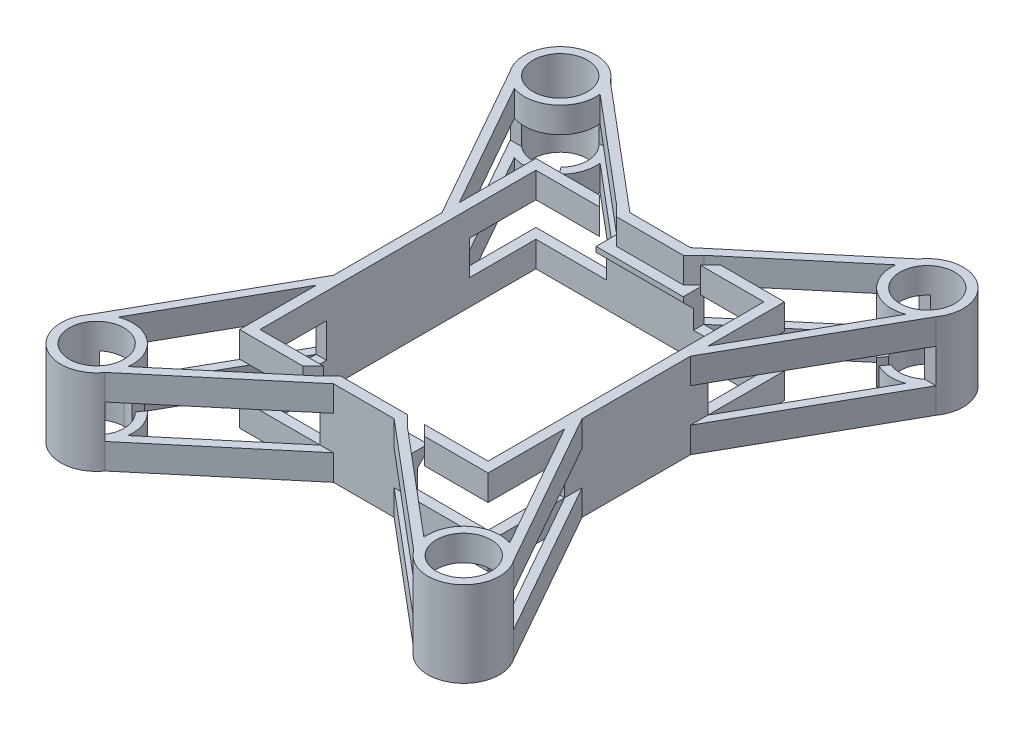
from build123d import *

# Parameters (mm, degrees)
SKETCH1_R               = 3.2
SKETCH1_W               = 26.7
SKETCH1_H               = 32.3
BOSS_EXTRUDE2_DEPTH     = 10
CUT_EXTRUDE1_DEPTH      = 68.219866013
SKETCH3_W               = 36.125771517
SKETCH3_H               = 4
CUT_EXTRUDE2_DEPTH      = 77.38869507
CUT_EXTRUDE3_REACH      = 60.207
CUT_EXTRUDE3_END_RADIUS = 3.2
SKETCH4_W               = 4.857578305
SKETCH4_H               = 4
CUT_EXTRUDE4_REACH      = 60.207
CUT_EXTRUDE4_END_RADIUS = 3.2
SKETCH5_W               = 4.857578305
SKETCH5_H               = 4
CUT_EXTRUDE5_REACH      = 60.207
CUT_EXTRUDE5_END_RADIUS = 3.2
SKETCH6_W               = 4.857578305
SKETCH6_H               = 4
CUT_EXTRUDE6_REACH      = 60.207
CUT_EXTRUDE6_END_RADIUS = 3.2
SKETCH7_W               = 4.857578305
SKETCH7_H               = 4
SKETCH8_W               = 10.205315409
SKETCH8_H               = 1.2
SKETCH8_W_2             = 1.2
SKETCH8_H_2             = 16.7681893
BOSS_EXTRUDE3_DEPTH     = 4
CUT_EXTRUDE7_DEPTH      = 52.578594453
SKETCH10_W              = 10.205315409
SKETCH10_H              = 0.6
BOSS_EXTRUDE4_DEPTH     = 1.2
CHAMFER1_SIZE           = 1.2
SKETCH12_W              = 10.205315409
SKETCH12_H              = 0.6
BOSS_EXTRUDE5_DEPTH     = 1.2
CHAMFER2_SIZE           = 1.2
CUT_EXTRUDE8_DEPTH      = 53.070638614
CUT_EXTRUDE8_DEPTH_BACK = 3


with BuildPart() as part:
    # Sketch1 → Boss-Extrude2 (new body)
    with BuildSketch(Plane(origin=(0, 0, 0), x_dir=(1, 0, 0), z_dir=(0, 1, 0))):
        with BuildLine():
            Line((-34.405486348, 30.435899661), (-24.03957695, 12.074655042))
            Line((-24.03957695, 12.074655042), (-24.03957695, -0.625344958))
            Line((-24.03957695, -0.625344958), (-34.405486348, -18.986589577))
            ThreePointArc((-34.405486348, -18.986589577), (-33.407763681, -24.841890549), (-27.552462708, -23.844167882))
            Line((-27.552462708, -23.844167882), (-13.03957695, -11.625344958))
            Line((-13.03957695, -11.625344958), (-5.93957695, -11.625344958))
            Line((-5.93957695, -11.625344958), (8.573308809, -23.844167882))
            ThreePointArc((8.573308809, -23.844167882), (14.428609781, -24.841890549), (15.426332449, -18.986589577))
            Line((15.426332449, -18.986589577), (5.06042305, -0.625344958))
            Line((5.06042305, -0.625344958), (5.06042305, 12.074655042))
            Line((5.06042305, 12.074655042), (15.426332449, 30.435899661))
            ThreePointArc((15.426332449, 30.435899661), (14.428609781, 36.291200634), (8.573308809, 35.293477966))
            Line((8.573308809, 35.293477966), (-5.93957695, 23.074655042))
            Line((-5.93957695, 23.074655042), (-13.03957695, 23.074655042))
            Line((-13.03957695, 23.074655042), (-27.552462708, 35.293477966))
            ThreePointArc((-27.552462708, 35.293477966), (-33.407763681, 36.291200634), (-34.405486348, 30.435899661))
        make_face()
        with Locations(Location((-30.978974528, 32.864688814, 0), (0, 0, 270))):
            Circle(SKETCH1_R, mode=Mode.SUBTRACT)
        with Locations(Location((11.999820629, 32.864688814, 0), (0, 0, 90))):
            Circle(SKETCH1_R, mode=Mode.SUBTRACT)
        with Locations(Location((-30.978974528, -21.415378729, 0), (0, 0, 90))):
            Circle(SKETCH1_R, mode=Mode.SUBTRACT)
        with Locations(Location((11.999820629, -21.415378729, 0), (0, 0, 270))):
            Circle(SKETCH1_R, mode=Mode.SUBTRACT)
        with BuildLine():
            Line((-24.03957695, 23.074655042), (-14.592234654, 23.074655042))
            Line((-14.592234654, 23.074655042), (-26.808244007, 33.359670553))
            ThreePointArc((-26.808244007, 33.359670553), (-28.363078678, 29.578796408), (-32.396270044, 28.911048286))
            Line((-32.396270044, 28.911048286), (-24.03957695, 14.108749692))
            Line((-24.03957695, 14.108749692), (-24.03957695, 23.074655042))
        make_face(mode=Mode.SUBTRACT)
        with Locations((-9.48957695, 5.724655042)):
            Rectangle(SKETCH1_W, SKETCH1_H, mode=Mode.SUBTRACT)
        with BuildLine():
            Line((5.06042305, 23.074655042), (5.06042305, 14.108749692))
            Line((5.06042305, 14.108749692), (13.417116145, 28.911048286))
            ThreePointArc((13.417116145, 28.911048286), (9.383924779, 29.578796408), (7.829090108, 33.359670553))
            Line((7.829090108, 33.359670553), (-4.386919245, 23.074655042))
            Line((-4.386919245, 23.074655042), (5.06042305, 23.074655042))
        make_face(mode=Mode.SUBTRACT)
        with BuildLine():
            Line((-24.03957695, -11.625344958), (-14.592234654, -11.625344958))
            Line((-14.592234654, -11.625344958), (-26.808244007, -21.910360468))
            ThreePointArc((-26.808244007, -21.910360468), (-28.363078678, -18.129486324), (-32.396270044, -17.461738202))
            Line((-32.396270044, -17.461738202), (-24.03957695, -2.659439608))
            Line((-24.03957695, -2.659439608), (-24.03957695, -11.625344958))
        make_face(mode=Mode.SUBTRACT)
        with BuildLine():
            Line((7.829090108, -21.910360468), (-4.386919245, -11.625344958))
            Line((-4.386919245, -11.625344958), (5.06042305, -11.625344958))
            Line((5.06042305, -11.625344958), (5.06042305, -2.659439608))
            Line((5.06042305, -2.659439608), (13.417116145, -17.461738202))
            ThreePointArc((13.417116145, -17.461738202), (9.383924779, -18.129486324), (7.829090108, -21.910360468))
        make_face(mode=Mode.SUBTRACT)
    extrude(amount=BOSS_EXTRUDE2_DEPTH)

    # Sketch2 → Cut-Extrude1 (cut, through all)
    with BuildSketch(Plane(origin=(20, 0, 0), x_dir=(0, 0, -1), z_dir=(1, 0, 0))):
        Polygon((-18.986589577, 5), (-18.986589577, 7), (-0.625344958, 7), (-0.625344958, 5), (-0.625344958, 3), (-18.986589577, 3), align=None)
        Polygon((30.435899661, 7), (12.074655042, 7), (12.074655042, 5), (12.074655042, 3), (30.435899661, 3), (30.435899661, 5), align=None)
    extrude(amount=-CUT_EXTRUDE1_DEPTH, mode=Mode.SUBTRACT)

    # Sketch3 → Cut-Extrude2 (cut, through all)
    with BuildSketch(Plane.XY.offset(30)):
        with Locations((-9.489576949, 5)):
            Rectangle(SKETCH3_W, SKETCH3_H)
    extrude(amount=-CUT_EXTRUDE2_DEPTH, mode=Mode.SUBTRACT)

    # Cut-Extrude3: up to this cylinder (the profile starts outside it)
    cut_extrude3_end = Plane(origin=(-30.978974528, 5, 21.415378729), z_dir=(0, -1, 0)) * Cylinder(CUT_EXTRUDE3_END_RADIUS, 127.814, mode=Mode.PRIVATE)
    # Sketch4 → Cut-Extrude3 (cut, up to the surface)
    with BuildSketch(Plane(origin=(-27.552462708, 0, 0), x_dir=(0, 0, -1), z_dir=(1, 0, 0)), mode=Mode.PRIVATE) as cut_extrude3_sk1:
        with Locations((-21.415378729, 5)):
            Rectangle(SKETCH4_W, SKETCH4_H)
    cut_extrude3_tool1 = extrude(cut_extrude3_sk1.sketch, amount=-CUT_EXTRUDE3_REACH, mode=Mode.PRIVATE) - cut_extrude3_end
    add(cut_extrude3_tool1.solids().sort_by_distance((-27.552463, 5, 21.415379))[0], mode=Mode.SUBTRACT)

    # Cut-Extrude4: up to this cylinder (the profile starts outside it)
    cut_extrude4_end = Plane(origin=(11.999820629, 5, 21.415378729), z_dir=(0, -1, 0)) * Cylinder(CUT_EXTRUDE4_END_RADIUS, 127.814, mode=Mode.PRIVATE)
    # Sketch5 → Cut-Extrude4 (cut, up to the surface)
    with BuildSketch(Plane.ZY.offset(-8.573308809), mode=Mode.PRIVATE) as cut_extrude4_sk1:
        with Locations((21.415378729, 5)):
            Rectangle(SKETCH5_W, SKETCH5_H)
    cut_extrude4_tool1 = extrude(cut_extrude4_sk1.sketch, amount=-CUT_EXTRUDE4_REACH, mode=Mode.PRIVATE) - cut_extrude4_end
    add(cut_extrude4_tool1.solids().sort_by_distance((8.573309, 5, 21.415379))[0], mode=Mode.SUBTRACT)

    # Cut-Extrude5: up to this cylinder (the profile starts outside it)
    cut_extrude5_end = Plane(origin=(-30.978974528, 5, -32.864688814), z_dir=(0, -1, 0)) * Cylinder(CUT_EXTRUDE5_END_RADIUS, 127.814, mode=Mode.PRIVATE)
    # Sketch6 → Cut-Extrude5 (cut, up to the surface)
    with BuildSketch(Plane(origin=(-27.552462708, 0, 0), x_dir=(0, 0, -1), z_dir=(1, 0, 0)), mode=Mode.PRIVATE) as cut_extrude5_sk1:
        with Locations((32.864688814, 5)):
            Rectangle(SKETCH6_W, SKETCH6_H)
    cut_extrude5_tool1 = extrude(cut_extrude5_sk1.sketch, amount=-CUT_EXTRUDE5_REACH, mode=Mode.PRIVATE) - cut_extrude5_end
    add(cut_extrude5_tool1.solids().sort_by_distance((-27.552463, 5, -32.864689))[0], mode=Mode.SUBTRACT)

    # Cut-Extrude6: up to this cylinder (the profile starts outside it)
    cut_extrude6_end = Plane(origin=(11.999820629, 5, -32.864688814), z_dir=(0, -1, 0)) * Cylinder(CUT_EXTRUDE6_END_RADIUS, 127.814, mode=Mode.PRIVATE)
    # Sketch7 → Cut-Extrude6 (cut, up to the surface)
    with BuildSketch(Plane.ZY.offset(-8.573308809), mode=Mode.PRIVATE) as cut_extrude6_sk1:
        with Locations((-32.864688814, 5)):
            Rectangle(SKETCH7_W, SKETCH7_H)
    cut_extrude6_tool1 = extrude(cut_extrude6_sk1.sketch, amount=-CUT_EXTRUDE6_REACH, mode=Mode.PRIVATE) - cut_extrude6_end
    add(cut_extrude6_tool1.solids().sort_by_distance((8.573309, 5, -32.864689))[0], mode=Mode.SUBTRACT)

    # Sketch8 → Boss-Extrude3 (add)
    with BuildSketch(Plane(origin=(0, 3, 0), x_dir=(1, 0, 0), z_dir=(0, 1, 0))):
        with Locations((-9.489576949, 22.474655042)):
            Rectangle(SKETCH8_W, SKETCH8_H)
        with Locations((-9.489576949, -11.025344958)):
            Rectangle(SKETCH8_W, SKETCH8_H)
        with Locations((-23.43957695, 5.724655042)):
            Rectangle(SKETCH8_W_2, SKETCH8_H_2)
        with Locations((4.46042305, 5.724655042)):
            Rectangle(SKETCH8_W_2, SKETCH8_H_2)
    extrude(amount=BOSS_EXTRUDE3_DEPTH)

    # Sketch9 → Cut-Extrude7 (cut, through all)
    with BuildSketch(Plane(origin=(0, 3, 0), x_dir=(1, 0, 0), z_dir=(0, 1, 0))):
        Polygon((-27.717427746, 29.299754586), (-28.696368176, 28.605726031), (-30.707626394, 31.442643867), (-29.728685964, 32.136672421), align=None)
        Polygon((11.728472495, 31.442643867), (10.749532065, 32.136672421), (8.738273847, 29.299754586), (9.717214277, 28.605726031), align=None)
        Polygon((9.717214277, -16.898697434), (11.728472495, -19.735615269), (10.749532065, -20.429643824), (8.738273847, -17.592725989), align=None)
        Polygon((-30.707626394, -19.735615269), (-29.728685964, -20.429643824), (-27.717427746, -17.592725989), (-28.696368176, -16.898697434), align=None)
    extrude(amount=-CUT_EXTRUDE7_DEPTH, mode=Mode.SUBTRACT)

    # Sketch10 → Boss-Extrude4 (add)
    with BuildSketch(Plane.XY.offset(-21.874655042)):
        with Locations((-9.489576949, 6.7)):
            Rectangle(SKETCH10_W, SKETCH10_H)
    extrude(amount=BOSS_EXTRUDE4_DEPTH)

    # Chamfer1
    chamfer1_edges = [part.edges().sort_by_distance(p)[0] for p in [
        (-9.48957695, 6.4, -21.874655042),
    ]]
    chamfer(chamfer1_edges, length=CHAMFER1_SIZE - 0.0001)  # a hair under: the kernel refuses the full size

    # Sketch12 → Boss-Extrude5 (add)
    with BuildSketch(Plane(origin=(0, 0, 10.425344958), x_dir=(-1, 0, 0), z_dir=(0, 0, -1))):
        with Locations((9.489576949, 6.7)):
            Rectangle(SKETCH12_W, SKETCH12_H)
    extrude(amount=BOSS_EXTRUDE5_DEPTH)

    # Chamfer2
    chamfer2_edges = [part.edges().sort_by_distance(p)[0] for p in [
        (-9.48957695, 6.4, 10.425344958),
    ]]
    chamfer(chamfer2_edges, length=CHAMFER2_SIZE - 0.0001)  # a hair under: the kernel refuses the full size

    # Sketch13 → Cut-Extrude8 (cut, two sides: drawn at the far end of the back side and taken through both)
    with BuildSketch(Plane(origin=(0, 10, 0), x_dir=(1, 0, 0), z_dir=(0, 1, 0)).offset(-CUT_EXTRUDE8_DEPTH_BACK)):
        Polygon((-14.592234654, 23.074655042), (-13.392234654, 21.874655042), (-15.393970224, 21.874655042), (-16.593970224, 23.074655042), align=None)
        Polygon((-3.585183676, 21.874655042), (-2.385183676, 23.074655042), (-4.386919245, 23.074655042), (-5.586919245, 21.874655042), align=None)
        Polygon((-5.586919245, -10.425344958), (-3.585183676, -10.425344958), (-2.385183676, -11.625344958), (-4.386919245, -11.625344958), align=None)
        Polygon((-15.393970224, -10.425344958), (-16.593970224, -11.625344958), (-14.592234654, -11.625344958), (-13.392234654, -10.425344958), align=None)
    extrude(amount=CUT_EXTRUDE8_DEPTH + CUT_EXTRUDE8_DEPTH_BACK, mode=Mode.SUBTRACT)


solid = part.part
